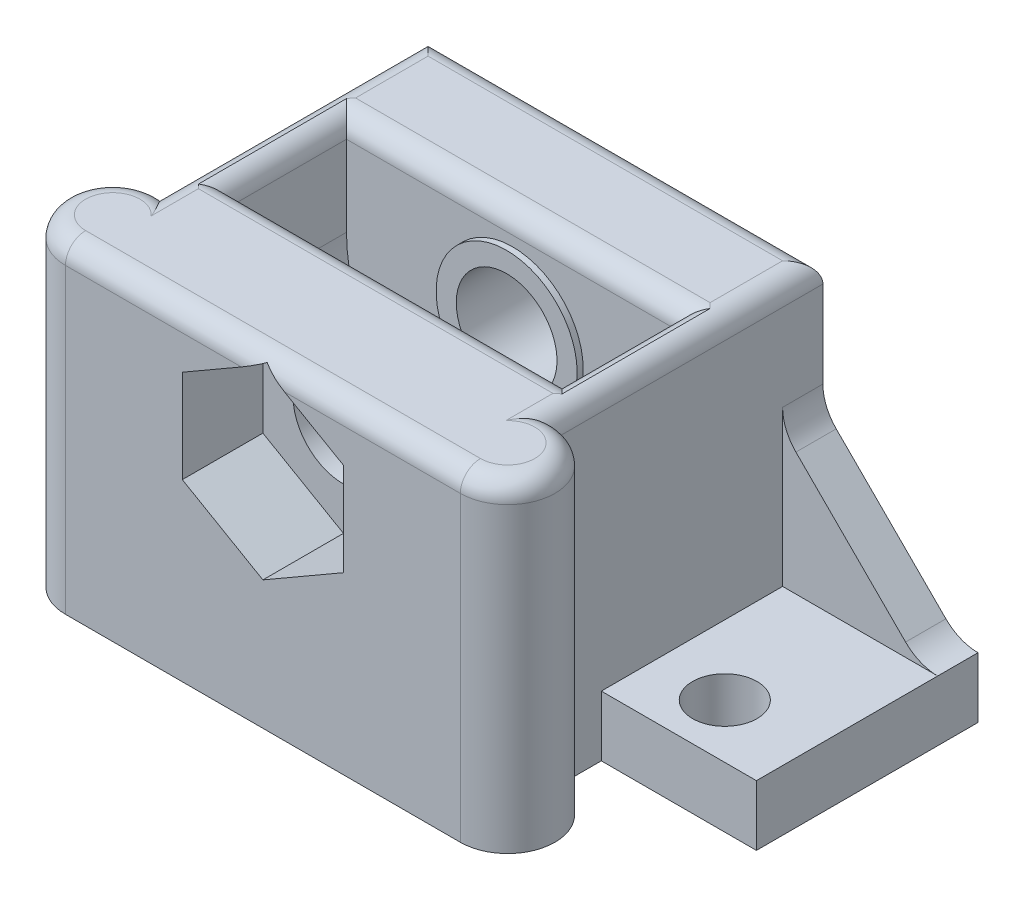
from build123d import *

# Parameters (mm, degrees)
BOSS_EXTRUDE1_DEPTH            = 16
CUT_EXTRUDE4_START             = -6.6
CUT_EXTRUDE4_DEPTH             = 5.8
CUT_EXTRUDE5_REACH             = 34.585
SKETCH6_R                      = 2.5
CUT_EXTRUDE6_DEPTH             = 4
SKETCH8_R                      = 3.5
SKETCH8_R_2                    = 2.5
BOSS_EXTRUDE2_DEPTH            = 0.3
SKETCH9_W                      = 7.7
SKETCH9_H                      = 11
BOSS_EXTRUDE3_DEPTH            = 3
CUT_EXTRUDE7_REACH             = 37.189
SKETCH10_R                     = 1.6
CUT_EXTRUDE7_DIRECTION_2_DEPTH = 36.189344978
BOSS_EXTRUDE4_DEPTH            = 2
FILLET1_R                      = 1


with BuildPart() as part:
    # Sketch1 → Boss-Extrude1 (new body)
    with BuildSketch(Plane(origin=(0, 0, 0), x_dir=(1, 0, 0), z_dir=(0, 1, 0))):
        with BuildLine():
            Line((0, 0), (19.6, 0))
            ThreePointArc((19.6, 0), (21.95, 2.35), (19.6, 4.7))
            Line((19.6, 4.7), (19.6, 18))
            Line((19.6, 18), (0, 18))
            Line((0, 18), (0, 4.7))
            ThreePointArc((0, 4.7), (-2.35, 2.35), (0, 0))
        make_face()
    extrude(amount=BOSS_EXTRUDE1_DEPTH)

    # Sketch5 → Cut-Extrude4 (cut)
    with BuildSketch(Plane.XY.offset(CUT_EXTRUDE4_START)):
        with BuildLine():
            Line((1.55, 11), (1.55, 16))
            Line((1.55, 16), (18.05, 16))
            Line((18.05, 16), (18.05, 11))
            ThreePointArc((18.05, 11), (9.8, 2.75), (1.55, 11))
        make_face()
    extrude(amount=-CUT_EXTRUDE4_DEPTH, mode=Mode.SUBTRACT)

    # Cut-Extrude5: up to this face of the body (flat: up to its plane)
    cut_extrude5_end = Plane(part.part.faces().sort_by_distance((9.8, 8, 0))[0])
    # Sketch6 → Cut-Extrude5 (cut, up to the picked face)
    with BuildSketch(Plane(origin=(0, 0, -18), x_dir=(-1, 0, 0), z_dir=(0, 0, -1)), mode=Mode.PRIVATE) as cut_extrude5_sk1:
        with Locations((-9.8, 11)):
            Circle(SKETCH6_R)
    cut_extrude5_tool1 = split(extrude(cut_extrude5_sk1.sketch, amount=-CUT_EXTRUDE5_REACH, mode=Mode.PRIVATE), bisect_by=cut_extrude5_end, keep=Keep.BOTH, mode=Mode.PRIVATE)
    add(cut_extrude5_tool1.solids().sort_by(Axis((9.8, 11, -18), (0, 0, 1)))[0], mode=Mode.SUBTRACT)

    # Sketch7 → Cut-Extrude6 (cut)
    with BuildSketch(Plane.XY):
        Polygon((9.8, 15.618802154), (5.8, 13.309401077), (5.8, 8.690598923), (9.8, 6.381197846), (13.8, 8.690598923), (13.8, 13.309401077), align=None)
    extrude(amount=-CUT_EXTRUDE6_DEPTH, mode=Mode.SUBTRACT)

    # Sketch8 → Boss-Extrude2 (add)
    with BuildSketch(Plane.XY.offset(-12.4)):
        with Locations((9.8, 11)):
            Circle(SKETCH8_R)
        with Locations(Location((9.8, 11, 0), (0, 0, 180))):
            Circle(SKETCH8_R_2, mode=Mode.SUBTRACT)
    boss_extrude2 = extrude(amount=BOSS_EXTRUDE2_DEPTH)

    # Mirror1: Boss-Extrude2 across plane
    add(boss_extrude2.mirror(Plane.XY.offset(-9.5)))

    # Sketch9 → Boss-Extrude3 (add)
    with BuildSketch(Plane.XZ):
        with Locations((-3.85, -12.5)):
            Rectangle(SKETCH9_W, SKETCH9_H)
        with Locations((23.45, -12.5)):
            Rectangle(SKETCH9_W, SKETCH9_H)
    extrude(amount=-BOSS_EXTRUDE3_DEPTH)

    # Sketch10 → Cut-Extrude7 (cut, up to next)
    with BuildSketch(Plane(origin=(0, 3, 0), x_dir=(1, 0, 0), z_dir=(0, 1, 0)), mode=Mode.PRIVATE) as cut_extrude7_sk1:
        with Locations(Location((-3.45, 9.68, 0), (0, 0, 270))):
            Circle(SKETCH10_R)
    cut_extrude7_tool1 = extrude(cut_extrude7_sk1.sketch, amount=-CUT_EXTRUDE7_REACH, mode=Mode.PRIVATE) & part.part
    # Sketch10 → Cut-Extrude7 (cut, up to next)
    with BuildSketch(Plane(origin=(0, 3, 0), x_dir=(1, 0, 0), z_dir=(0, 1, 0)), mode=Mode.PRIVATE) as cut_extrude7_sk2:
        with Locations(Location((23.05, 9.68, 0), (0, 0, 90))):
            Circle(SKETCH10_R)
    cut_extrude7_tool2 = extrude(cut_extrude7_sk2.sketch, amount=-CUT_EXTRUDE7_REACH, mode=Mode.PRIVATE) & part.part
    add(cut_extrude7_tool1.solids().sort_by_distance((-3.45, 3, -9.68))[0], mode=Mode.SUBTRACT)
    add(cut_extrude7_tool2.solids().sort_by_distance((23.05, 3, -9.68))[0], mode=Mode.SUBTRACT)

    # Sketch10 → Cut-Extrude7 direction 2 (cut)
    with BuildSketch(Plane(origin=(0, 3, 0), x_dir=(1, 0, 0), z_dir=(0, 1, 0))):
        with Locations(Location((-3.45, 9.68, 0), (0, 0, 270))):
            Circle(SKETCH10_R)
        with Locations(Location((23.05, 9.68, 0), (0, 0, 90))):
            Circle(SKETCH10_R)
    extrude(amount=CUT_EXTRUDE7_DIRECTION_2_DEPTH, mode=Mode.SUBTRACT)

    # Sketch12 → Boss-Extrude4 (add)
    with BuildSketch(Plane(origin=(0, 0, -18), x_dir=(-1, 0, 0), z_dir=(0, 0, -1))):
        with BuildLine():
            Line((-19.6, 3), (-27.3, 3))
            ThreePointArc((-27.3, 3), (-26.436942556, 3.171672799), (-25.705277785, 3.66055557))
            Line((-25.705277785, 3.66055557), (-20.26055557, 9.105277785))
            ThreePointArc((-20.26055557, 9.105277785), (-19.771672799, 9.836942556), (-19.6, 10.7))
            Line((-19.6, 10.7), (-19.6, 3))
        make_face()
        with BuildLine():
            Line((0, 10.7), (0, 3))
            Line((0, 3), (7.7, 3))
            ThreePointArc((7.7, 3), (6.836942556, 3.171672799), (6.105277785, 3.66055557))
            Line((6.105277785, 3.66055557), (0.66055557, 9.105277785))
            ThreePointArc((0.66055557, 9.105277785), (0.171672799, 9.836942556), (0, 10.7))
        make_face()
    extrude(amount=-BOSS_EXTRUDE4_DEPTH)

    # Fillet1
    # the kernel refuses this fillet: 1 mm, written as the material it takes off along each edge
    with BuildSketch(Plane(origin=(19.6, 16, -2.35), x_dir=(0, 0, 1), z_dir=(-1, 0, 0))) as fillet1_piece_1:
        with BuildLine():
            CenterArc((2.35 - FILLET1_R, -FILLET1_R), FILLET1_R, 0, 90)
            Line((2.35, -FILLET1_R), (2.35, 0))
            Line((2.35, 0), (2.35 - FILLET1_R, 0))
        make_face()
    revolve(axis=Axis((19.6, 16, -2.35), (0, 1, 0)), revolution_arc=180, mode=Mode.SUBTRACT)
    with BuildSketch(Plane(origin=(19.6, 16, -2.2), x_dir=(-1, 0, 0), z_dir=(0, 0, -1))) as fillet1_piece_2_section:
        with BuildLine():
            CenterArc((FILLET1_R, -FILLET1_R), FILLET1_R, 90, 90)
            Line((0, -FILLET1_R), (0, 0))
            Line((0, 0), (FILLET1_R, 0))
        make_face()
    fillet1_piece_2 = extrude(amount=18.3, mode=Mode.PRIVATE)
    fillet1_piece_2 = fillet1_piece_2 - Plane(origin=(19.6, 15.773826921, -2.35), x_dir=(0, 0, 1), z_dir=(0, -1, 0)) * Cylinder(2.35, 41, mode=Mode.PRIVATE)
    add(fillet1_piece_2, mode=Mode.SUBTRACT)
    with BuildSketch(Plane(origin=(22.1, 16, -18), x_dir=(0, 0, 1), z_dir=(-1, 0, 0))) as fillet1_piece_3:
        with BuildLine():
            CenterArc((FILLET1_R, -FILLET1_R), FILLET1_R, 90, 90)
            Line((0, -FILLET1_R), (0, 0))
            Line((0, 0), (FILLET1_R, 0))
        make_face()
    extrude(amount=24.6, mode=Mode.SUBTRACT)
    with BuildSketch(Plane(origin=(0, 16, -20.5), x_dir=(1, 0, 0), z_dir=(0, 0, 1))) as fillet1_piece_4_section:
        with BuildLine():
            CenterArc((FILLET1_R, -FILLET1_R), FILLET1_R, 90, 90)
            Line((0, -FILLET1_R), (0, 0))
            Line((0, 0), (FILLET1_R, 0))
        make_face()
    fillet1_piece_4 = extrude(amount=18.3, mode=Mode.PRIVATE)
    fillet1_piece_4 = fillet1_piece_4 - Plane(origin=(0, 15.773826886, -2.35), x_dir=(0, 0, -1), z_dir=(0, -1, 0)) * Cylinder(2.35, 41, mode=Mode.PRIVATE)
    add(fillet1_piece_4, mode=Mode.SUBTRACT)
    with BuildSketch(Plane(origin=(1.55, 16, -12.4), x_dir=(0, 0, -1), z_dir=(1, 0, 0))) as fillet1_piece_5:
        with BuildLine():
            CenterArc((FILLET1_R, -FILLET1_R), FILLET1_R, 90, 90)
            Line((0, -FILLET1_R), (0, 0))
            Line((0, 0), (FILLET1_R, 0))
        make_face()
    extrude(amount=16.5, mode=Mode.SUBTRACT)
    with BuildSketch(Plane(origin=(1.55, 16, -6.6), x_dir=(-1, 0, 0), z_dir=(0, 0, -1))) as fillet1_piece_6:
        with BuildLine():
            CenterArc((FILLET1_R, -FILLET1_R), FILLET1_R, 90, 90)
            Line((0, -FILLET1_R), (0, 0))
            Line((0, 0), (FILLET1_R, 0))
        make_face()
    extrude(amount=5.8, mode=Mode.SUBTRACT)
    with BuildSketch(Plane(origin=(18.05, 16, -6.6), x_dir=(1, 0, 0), z_dir=(0, 0, -1))) as fillet1_piece_7:
        with BuildLine():
            CenterArc((FILLET1_R, FILLET1_R), FILLET1_R, 180, 90)
            Line((0, FILLET1_R), (0, 0))
            Line((0, 0), (FILLET1_R, 0))
        make_face()
    extrude(amount=5.8, mode=Mode.SUBTRACT)
    with BuildSketch(Plane(origin=(1.55, 16, -6.6), x_dir=(0, 0, 1), z_dir=(1, 0, 0))) as fillet1_piece_8:
        with BuildLine():
            CenterArc((FILLET1_R, FILLET1_R), FILLET1_R, 180, 90)
            Line((0, FILLET1_R), (0, 0))
            Line((0, 0), (FILLET1_R, 0))
        make_face()
    extrude(amount=16.5, mode=Mode.SUBTRACT)
    with BuildSketch(Plane(origin=(0, 16, -2.35), x_dir=(0, 0, -1), z_dir=(1, 0, 0))) as fillet1_piece_9:
        with BuildLine():
            CenterArc((2.35 - FILLET1_R, -FILLET1_R), FILLET1_R, 0, 90)
            Line((2.35 - FILLET1_R, 0), (2.35, 0))
            Line((2.35, 0), (2.35, -FILLET1_R))
        make_face()
    revolve(axis=Axis((0, 16, -2.35), (0, 1, 0)), revolution_arc=180, mode=Mode.SUBTRACT)
    with BuildSketch(Plane(origin=(0, 16, 0), x_dir=(0, -1, 0), z_dir=(1, 0, 0))) as fillet1_piece_10:
        with BuildLine():
            CenterArc((FILLET1_R, FILLET1_R), FILLET1_R, 180, 90)
            Line((0, FILLET1_R), (0, 0))
            Line((0, 0), (FILLET1_R, 0))
        make_face()
    extrude(amount=19.6, mode=Mode.SUBTRACT)
    with BuildSketch(Plane(origin=(19.6, 16, -2.35), x_dir=(0, 0, 1), z_dir=(-1, 0, 0))) as fillet1_piece_11a_section:
        with BuildLine():
            CenterArc((2.35 - FILLET1_R, -FILLET1_R), FILLET1_R, 0, 90)
            Line((2.35, -FILLET1_R), (2.35, 0))
            Line((2.35, 0), (2.35 - FILLET1_R, 0))
        make_face()
    fillet1_piece_11a = revolve(axis=Axis((19.6, 16, -2.35), (0, 1, 0)), revolution_arc=241.050980809, mode=Mode.PRIVATE)
    fillet1_piece_11a = split(fillet1_piece_11a, bisect_by=Plane(origin=(19.6, 15.760675593, -4.111934827), z_dir=(-1, 0, 0)), keep=Keep.TOP, mode=Mode.PRIVATE)
    with BuildSketch(Plane(origin=(19.6, 16, -2.2), x_dir=(-1, 0, 0), z_dir=(0, 0, -1))) as fillet1_piece_11b_section:
        with BuildLine():
            CenterArc((FILLET1_R, -FILLET1_R), FILLET1_R, 90, 90)
            Line((0, -FILLET1_R), (0, 0))
            Line((0, 0), (FILLET1_R, 0))
        make_face()
    fillet1_piece_11b = extrude(amount=18.3, mode=Mode.PRIVATE)
    fillet1_piece_11b = fillet1_piece_11b & Plane(origin=(19.6, 15.772187807, -2.35), x_dir=(0, 0, 1), z_dir=(0, -1, 0)) * Cylinder(2.35, 41, mode=Mode.PRIVATE)
    fillet1_piece_11 = fillet1_piece_11a & fillet1_piece_11b
    add(fillet1_piece_11, mode=Mode.SUBTRACT)
    with BuildSketch(Plane(origin=(0, 16, -2.35), x_dir=(0.8750507362013609, 0, -0.4840312067144602), z_dir=(0.4840312067144602, 0, 0.8750507362013609))) as fillet1_piece_12a_section:
        with BuildLine():
            CenterArc((2.35 - FILLET1_R, -FILLET1_R), FILLET1_R, 0, 90)
            Line((2.35 - FILLET1_R, 0), (2.35, 0))
            Line((2.35, 0), (2.35, -FILLET1_R))
        make_face()
    fillet1_piece_12a = revolve(axis=Axis((0, 16, -2.35), (0, 1, 0)), revolution_arc=241.050980809, mode=Mode.PRIVATE)
    fillet1_piece_12a = split(fillet1_piece_12a, bisect_by=Plane(origin=(0, 15.760675593, -4.111934827), z_dir=(1, 0, 0)), keep=Keep.TOP, mode=Mode.PRIVATE)
    with BuildSketch(Plane(origin=(0, 16, -20.5), x_dir=(1, 0, 0), z_dir=(0, 0, 1))) as fillet1_piece_12b_section:
        with BuildLine():
            CenterArc((FILLET1_R, -FILLET1_R), FILLET1_R, 90, 90)
            Line((0, -FILLET1_R), (0, 0))
            Line((0, 0), (FILLET1_R, 0))
        make_face()
    fillet1_piece_12b = extrude(amount=18.3, mode=Mode.PRIVATE)
    fillet1_piece_12b = fillet1_piece_12b & Plane(origin=(0, 15.772187772, -2.35), x_dir=(0, 0, -1), z_dir=(0, -1, 0)) * Cylinder(2.35, 41, mode=Mode.PRIVATE)
    fillet1_piece_12 = fillet1_piece_12a & fillet1_piece_12b
    add(fillet1_piece_12, mode=Mode.SUBTRACT)
    with BuildSketch(Plane(origin=(-0.95, 16, -12.4), x_dir=(0, 0, -1), z_dir=(1, 0, 0))) as fillet1_piece_13a_section:
        with BuildLine():
            CenterArc((FILLET1_R, -FILLET1_R), FILLET1_R, 90, 90)
            Line((0, -FILLET1_R), (0, 0))
            Line((0, 0), (FILLET1_R, 0))
        make_face()
    fillet1_piece_13a = extrude(amount=19, mode=Mode.PRIVATE)
    fillet1_piece_13a = split(fillet1_piece_13a, bisect_by=Plane(origin=(1.55, 15.773604886, -12.626395114), z_dir=(-1, 0, 0)), keep=Keep.TOP, mode=Mode.PRIVATE)
    with BuildSketch(Plane(origin=(1.55, 16, -6.6), x_dir=(-1, 0, 0), z_dir=(0, 0, -1))) as fillet1_piece_13b_section:
        with BuildLine():
            CenterArc((FILLET1_R, -FILLET1_R), FILLET1_R, 90, 90)
            Line((0, -FILLET1_R), (0, 0))
            Line((0, 0), (FILLET1_R, 0))
        make_face()
    fillet1_piece_13b = extrude(amount=8.3, mode=Mode.PRIVATE)
    fillet1_piece_13b = split(fillet1_piece_13b, bisect_by=Plane(origin=(1.323604886, 15.773604886, -12.4), z_dir=(0, 0, -1)), keep=Keep.TOP, mode=Mode.PRIVATE)
    fillet1_piece_13 = fillet1_piece_13a & fillet1_piece_13b
    add(fillet1_piece_13, mode=Mode.SUBTRACT)
    with BuildSketch(Plane(origin=(18.05, 16, -6.6), x_dir=(1, 0, 0), z_dir=(0, 0, -1))) as fillet1_piece_14a_section:
        with BuildLine():
            CenterArc((FILLET1_R, FILLET1_R), FILLET1_R, 180, 90)
            Line((0, FILLET1_R), (0, 0))
            Line((0, 0), (FILLET1_R, 0))
        make_face()
    fillet1_piece_14a = extrude(amount=8.3, mode=Mode.PRIVATE)
    fillet1_piece_14a = split(fillet1_piece_14a, bisect_by=Plane(origin=(18.276395114, 15.773604886, -12.4), z_dir=(0, 0, -1)), keep=Keep.TOP, mode=Mode.PRIVATE)
    with BuildSketch(Plane(origin=(1.55, 16, -12.4), x_dir=(0, 0, -1), z_dir=(1, 0, 0))) as fillet1_piece_14b_section:
        with BuildLine():
            CenterArc((FILLET1_R, -FILLET1_R), FILLET1_R, 90, 90)
            Line((0, -FILLET1_R), (0, 0))
            Line((0, 0), (FILLET1_R, 0))
        make_face()
    fillet1_piece_14b = extrude(amount=19, mode=Mode.PRIVATE)
    fillet1_piece_14b = split(fillet1_piece_14b, bisect_by=Plane(origin=(18.05, 15.773604886, -12.626395114), z_dir=(1, 0, 0)), keep=Keep.TOP, mode=Mode.PRIVATE)
    fillet1_piece_14 = fillet1_piece_14a & fillet1_piece_14b
    add(fillet1_piece_14, mode=Mode.SUBTRACT)
    with BuildSketch(Plane(origin=(-0.95, 16, -6.6), x_dir=(0, 0, 1), z_dir=(1, 0, 0))) as fillet1_piece_15a_section:
        with BuildLine():
            CenterArc((FILLET1_R, FILLET1_R), FILLET1_R, 180, 90)
            Line((0, FILLET1_R), (0, 0))
            Line((0, 0), (FILLET1_R, 0))
        make_face()
    fillet1_piece_15a = extrude(amount=19, mode=Mode.PRIVATE)
    fillet1_piece_15a = split(fillet1_piece_15a, bisect_by=Plane(origin=(1.55, 15.773604886, -6.373604886), z_dir=(-1, 0, 0)), keep=Keep.TOP, mode=Mode.PRIVATE)
    with BuildSketch(Plane(origin=(1.55, 16, -4.1), x_dir=(-1, 0, 0), z_dir=(0, 0, -1))) as fillet1_piece_15b_section:
        with BuildLine():
            CenterArc((FILLET1_R, -FILLET1_R), FILLET1_R, 90, 90)
            Line((0, -FILLET1_R), (0, 0))
            Line((0, 0), (FILLET1_R, 0))
        make_face()
    fillet1_piece_15b = extrude(amount=8.3, mode=Mode.PRIVATE)
    fillet1_piece_15b = split(fillet1_piece_15b, bisect_by=Plane(origin=(1.323604886, 15.773604886, -6.6), z_dir=(0, 0, 1)), keep=Keep.TOP, mode=Mode.PRIVATE)
    fillet1_piece_15 = fillet1_piece_15a & fillet1_piece_15b
    add(fillet1_piece_15, mode=Mode.SUBTRACT)
    with BuildSketch(Plane(origin=(1.55, 16, -6.6), x_dir=(0, 0, 1), z_dir=(1, 0, 0))) as fillet1_piece_16a_section:
        with BuildLine():
            CenterArc((FILLET1_R, FILLET1_R), FILLET1_R, 180, 90)
            Line((0, FILLET1_R), (0, 0))
            Line((0, 0), (FILLET1_R, 0))
        make_face()
    fillet1_piece_16a = extrude(amount=19, mode=Mode.PRIVATE)
    fillet1_piece_16a = split(fillet1_piece_16a, bisect_by=Plane(origin=(18.05, 15.773604886, -6.373604886), z_dir=(1, 0, 0)), keep=Keep.TOP, mode=Mode.PRIVATE)
    with BuildSketch(Plane(origin=(18.05, 16, -4.1), x_dir=(1, 0, 0), z_dir=(0, 0, -1))) as fillet1_piece_16b_section:
        with BuildLine():
            CenterArc((FILLET1_R, FILLET1_R), FILLET1_R, 180, 90)
            Line((0, FILLET1_R), (0, 0))
            Line((0, 0), (FILLET1_R, 0))
        make_face()
    fillet1_piece_16b = extrude(amount=8.3, mode=Mode.PRIVATE)
    fillet1_piece_16b = split(fillet1_piece_16b, bisect_by=Plane(origin=(18.276395114, 15.773604886, -6.6), z_dir=(0, 0, 1)), keep=Keep.TOP, mode=Mode.PRIVATE)
    fillet1_piece_16 = fillet1_piece_16a & fillet1_piece_16b
    add(fillet1_piece_16, mode=Mode.SUBTRACT)


solid = part.part
